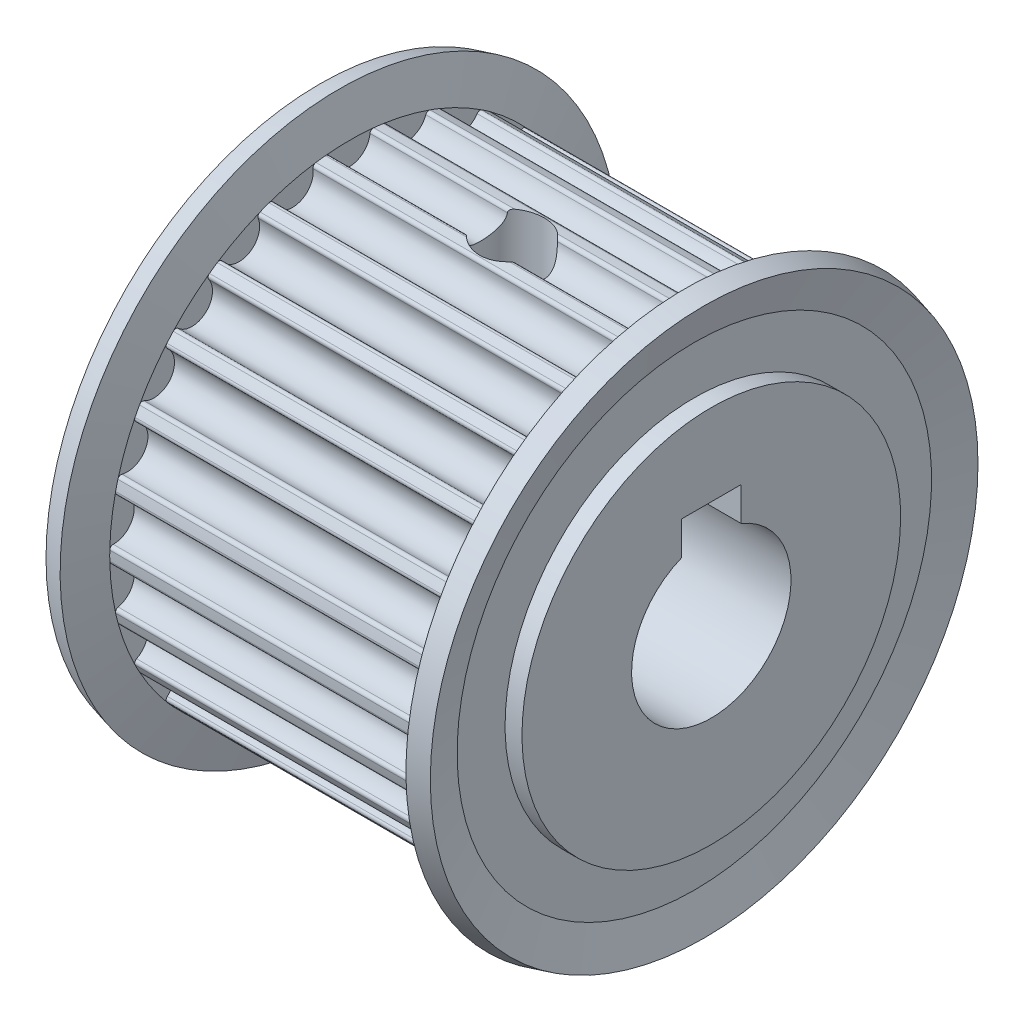
from build123d import *

# Parameters (mm, degrees)
CUT_EXTRUDE1_DEPTH       = 8.15
CUT_EXTRUDE1_DEPTH_BACK  = 8.15
CUT_EXTRUDE2_DEPTH       = 8.15
CUT_EXTRUDE2_DEPTH_BACK  = 8.15
CUT_EXTRUDE3_DEPTH       = 8.15
CUT_EXTRUDE3_DEPTH_BACK  = 8.15
CUT_EXTRUDE4_DEPTH       = 8.15
CUT_EXTRUDE4_DEPTH_BACK  = 8.15
CUT_EXTRUDE5_DEPTH       = 8.15
CUT_EXTRUDE5_DEPTH_BACK  = 8.15
CUT_EXTRUDE6_DEPTH       = 8.15
CUT_EXTRUDE6_DEPTH_BACK  = 8.15
CUT_EXTRUDE7_DEPTH       = 8.15
CUT_EXTRUDE7_DEPTH_BACK  = 8.15
CUT_EXTRUDE8_DEPTH       = 8.15
CUT_EXTRUDE8_DEPTH_BACK  = 8.15
CUT_EXTRUDE9_DEPTH       = 8.15
CUT_EXTRUDE9_DEPTH_BACK  = 8.15
CUT_EXTRUDE10_DEPTH      = 8.15
CUT_EXTRUDE10_DEPTH_BACK = 8.15
CUT_EXTRUDE11_DEPTH      = 8.15
CUT_EXTRUDE11_DEPTH_BACK = 8.15
CUT_EXTRUDE12_DEPTH      = 8.15
CUT_EXTRUDE12_DEPTH_BACK = 8.15
CUT_EXTRUDE13_DEPTH      = 8.15
CUT_EXTRUDE13_DEPTH_BACK = 8.15
CUT_EXTRUDE14_DEPTH      = 8.15
CUT_EXTRUDE14_DEPTH_BACK = 8.15
CUT_EXTRUDE15_DEPTH      = 8.15
CUT_EXTRUDE15_DEPTH_BACK = 8.15
CUT_EXTRUDE16_DEPTH      = 8.15
CUT_EXTRUDE16_DEPTH_BACK = 8.15
CUT_EXTRUDE17_DEPTH      = 8.15
CUT_EXTRUDE17_DEPTH_BACK = 8.15
CUT_EXTRUDE18_DEPTH      = 8.15
CUT_EXTRUDE18_DEPTH_BACK = 8.15
CUT_EXTRUDE19_DEPTH      = 8.15
CUT_EXTRUDE19_DEPTH_BACK = 8.15
CUT_EXTRUDE20_DEPTH      = 8.15
CUT_EXTRUDE20_DEPTH_BACK = 8.15
CUT_EXTRUDE21_DEPTH      = 8.15
CUT_EXTRUDE21_DEPTH_BACK = 8.15
CUT_EXTRUDE22_DEPTH      = 8.15
CUT_EXTRUDE22_DEPTH_BACK = 8.15
CUT_EXTRUDE23_DEPTH      = 8.15
CUT_EXTRUDE23_DEPTH_BACK = 8.15
CUT_EXTRUDE24_DEPTH      = 8.15
CUT_EXTRUDE24_DEPTH_BACK = 8.15
CUT_EXTRUDE25_DEPTH      = 8.15
CUT_EXTRUDE25_DEPTH_BACK = 8.15
CUT_EXTRUDE26_DEPTH      = 8.15
CUT_EXTRUDE26_DEPTH_BACK = 8.15
SKETCH28_W               = 20
SKETCH28_H               = 4
SKETCH29_W               = 1.621
SKETCH29_H               = 12.035
SKETCH31_W               = 3
SKETCH31_H               = 5.4
CUT_EXTRUDE27_DEPTH      = 20


with BuildPart() as part:
    # Sketch1 → Revolve1 (revolve)
    with BuildSketch(Plane.XY):
        Polygon((0, 0), (0, 9.5), (0.85, 9.5), (0.85, 11.903347502), (0.357554011, 13.741180955), (1.323479837, 14), (1.85, 12.035), (18.15, 12.035), (18.676520163, 14), (19.642445989, 13.741180955), (19.15, 11.903347502), (19.15, 9.5), (20, 9.5), (20, 0), align=None)
    revolve(axis=Axis((20, 0, 0), (-1, 0, 0)))

    # Sketch2 → Cut-Extrude1 (cut, two sides: drawn at the far end of the back side and taken through both)
    with BuildSketch(Plane(origin=(10, 0, 0), x_dir=(0, 0, -1), z_dir=(1, 0, 0)).offset(-CUT_EXTRUDE1_DEPTH_BACK)):
        with BuildLine():
            Line((-1.249308054, 12.3519818), (-1.211069064, 11.97391067))
            ThreePointArc((-1.211069064, 11.97391067), (-1.086431486, 11.936444223), (-1.024817519, 11.821805749))
            ThreePointArc((-1.024817519, 11.821805749), (1e-09, 10.895), (1.024817519, 11.821805751))
            ThreePointArc((1.024817519, 11.821805751), (1.086431486, 11.936444223), (1.211069064, 11.97391067))
            Line((1.211069064, 11.97391067), (1.249308054, 12.3519818))
            ThreePointArc((1.249308054, 12.3519818), (0, 12.415), (-1.249308054, 12.3519818))
        make_face()
    extrude(amount=CUT_EXTRUDE1_DEPTH + CUT_EXTRUDE1_DEPTH_BACK, mode=Mode.SUBTRACT)

    # Sketch3 → Cut-Extrude2 (cut, two sides: drawn at the far end of the back side and taken through both)
    with BuildSketch(Plane(origin=(10, 0, 0), x_dir=(0, 0, -1), z_dir=(1, 0, 0)).offset(-CUT_EXTRUDE2_DEPTH_BACK)):
        with BuildLine():
            Line((-4.169028162, 11.694076671), (-4.041421984, 11.33614279))
            ThreePointArc((-4.041421984, 11.33614279), (-3.91143984, 11.329592774), (-3.82418148, 11.233030674))
            ThreePointArc((-3.82418148, 11.233030674), (-2.607344162, 10.578411101), (-1.834105112, 11.723540446))
            ThreePointArc((-1.834105112, 11.723540446), (-1.801716317, 11.84959292), (-1.689666788, 11.915798385))
            Line((-1.689666788, 11.915798385), (-1.743017297, 12.292034644))
            ThreePointArc((-1.743017297, 12.292034644), (-2.971103972, 12.054242663), (-4.169028162, 11.694076671))
        make_face()
    extrude(amount=CUT_EXTRUDE2_DEPTH + CUT_EXTRUDE2_DEPTH_BACK, mode=Mode.SUBTRACT)

    # Sketch4 → Cut-Extrude3 (cut, two sides: drawn at the far end of the back side and taken through both)
    with BuildSketch(Plane(origin=(10, 0, 0), x_dir=(0, 0, -1), z_dir=(1, 0, 0)).offset(-CUT_EXTRUDE3_DEPTH_BACK)):
        with BuildLine():
            Line((-6.846459507, 10.356554312), (-6.636902148, 10.039559496))
            ThreePointArc((-6.636902148, 10.039559496), (-6.509129527, 10.064306575), (-6.401297914, 9.991432686))
            ThreePointArc((-6.401297914, 9.991432686), (-5.063158959, 9.6470434), (-4.58643622, 10.943945584))
            ThreePointArc((-4.58643622, 10.943945584), (-4.585154916, 11.074086349), (-4.492205348, 11.16518321))
            Line((-4.492205348, 11.16518321), (-4.634044819, 11.517719115))
            ThreePointArc((-4.634044819, 11.517719115), (-5.769538181, 10.992936558), (-6.846459507, 10.356554312))
        make_face()
    extrude(amount=CUT_EXTRUDE3_DEPTH + CUT_EXTRUDE3_DEPTH_BACK, mode=Mode.SUBTRACT)

    # Sketch5 → Cut-Extrude4 (cut, two sides: drawn at the far end of the back side and taken through both)
    with BuildSketch(Plane(origin=(10, 0, 0), x_dir=(0, 0, -1), z_dir=(1, 0, 0)).offset(-CUT_EXTRUDE4_DEPTH_BACK)):
        with BuildLine():
            Line((-9.125999512, 8.417146661), (-8.846669684, 8.159513497))
            ThreePointArc((-8.846669684, 8.159513497), (-8.728532267, 8.214119461), (-8.606394181, 8.169168949))
            ThreePointArc((-8.606394181, 8.169168949), (-7.224721361, 8.155024602), (-7.072220327, 9.528328384))
            ThreePointArc((-7.072220327, 9.528328384), (-7.102120978, 9.654994131), (-7.033673262, 9.765688171))
            Line((-7.033673262, 9.765688171), (-7.2557585, 10.074035616))
            ThreePointArc((-7.2557585, 10.074035616), (-8.232667802, 9.292760939), (-9.125999512, 8.417146661))
        make_face()
    extrude(amount=CUT_EXTRUDE4_DEPTH + CUT_EXTRUDE4_DEPTH_BACK, mode=Mode.SUBTRACT)

    # Sketch6 → Cut-Extrude5 (cut, two sides: drawn at the far end of the back side and taken through both)
    with BuildSketch(Plane(origin=(10, 0, 0), x_dir=(0, 0, -1), z_dir=(1, 0, 0)).offset(-CUT_EXTRUDE5_DEPTH_BACK)):
        with BuildLine():
            Line((-10.875169596, 5.988565041), (-10.542300934, 5.805266232))
            ThreePointArc((-10.542300934, 5.805266232), (-10.440664438, 5.88655758), (-10.311318101, 5.872142805))
            ThreePointArc((-10.311318101, 5.872142805), (-8.966409218, 6.189065416), (-9.146992694, 7.558959373))
            ThreePointArc((-9.146992694, 7.558959373), (-9.206337585, 7.674788749), (-9.166369652, 7.798646832))
            Line((-9.166369652, 7.798646832), (-9.45579387, 8.044885785))
            ThreePointArc((-9.45579387, 8.044885785), (-10.217344695, 7.052523831), (-10.875169596, 5.988565041))
        make_face()
    extrude(amount=CUT_EXTRUDE5_DEPTH + CUT_EXTRUDE5_DEPTH_BACK, mode=Mode.SUBTRACT)

    # Sketch7 → Cut-Extrude6 (cut, two sides: drawn at the far end of the back side and taken through both)
    with BuildSketch(Plane(origin=(10, 0, 0), x_dir=(0, 0, -1), z_dir=(1, 0, 0)).offset(-CUT_EXTRUDE6_DEPTH_BACK)):
        with BuildLine():
            Line((-11.992314354, 3.211949789), (-11.625251973, 3.113637995))
            ThreePointArc((-11.625251973, 3.113637995), (-11.546023142, 3.21689037), (-11.416985694, 3.233849067))
            ThreePointArc((-11.416985694, 3.233849067), (-10.187001964, 3.863420245), (-10.690175094, 5.150291119))
            ThreePointArc((-10.690175094, 5.150291119), (-10.775515314, 5.248552542), (-10.766349956, 5.378376486))
            Line((-10.766349956, 5.378376486), (-11.106292871, 5.548196433))
            ThreePointArc((-11.106292871, 5.548196433), (-11.608226653, 4.402419673), (-11.992314354, 3.211949789))
        make_face()
    extrude(amount=CUT_EXTRUDE6_DEPTH + CUT_EXTRUDE6_DEPTH_BACK, mode=Mode.SUBTRACT)

    # Sketch8 → Cut-Extrude7 (cut, two sides: drawn at the far end of the back side and taken through both)
    with BuildSketch(Plane(origin=(10, 0, 0), x_dir=(0, 0, -1), z_dir=(1, 0, 0)).offset(-CUT_EXTRUDE7_DEPTH_BACK)):
        with BuildLine():
            Line((-12.412509391, 0.248667689), (-12.032585624, 0.241056435))
            ThreePointArc((-12.032585624, 0.241056435), (-11.980368949, 0.360269184), (-11.859139576, 0.407615774))
            ThreePointArc((-11.859139576, 0.407615774), (-10.815563183, 1.313247132), (-11.612083375, 2.442306665))
            ThreePointArc((-11.612083375, 2.442306665), (-11.718459261, 2.517289538), (-11.740629135, 2.645534449))
            Line((-11.740629135, 2.645534449), (-12.1113345, 2.729066072))
            ThreePointArc((-12.1113345, 2.729066072), (-12.324480672, 1.496462885), (-12.412509391, 0.248667689))
        make_face()
    extrude(amount=CUT_EXTRUDE7_DEPTH + CUT_EXTRUDE7_DEPTH_BACK, mode=Mode.SUBTRACT)

    # Sketch9 → Cut-Extrude8 (cut, two sides: drawn at the far end of the back side and taken through both)
    with BuildSketch(Plane(origin=(10, 0, 0), x_dir=(0, 0, -1), z_dir=(1, 0, 0)).offset(-CUT_EXTRUDE8_DEPTH_BACK)):
        with BuildLine():
            Line((-12.1113345, -2.729066072), (-11.740629135, -2.645534449))
            ThreePointArc((-11.740629135, -2.645534449), (-11.71845926, -2.517289538), (-11.612083373, -2.442306665))
            ThreePointArc((-11.612083373, -2.442306665), (-10.815563183, -1.313247131), (-11.859139578, -0.407615775))
            ThreePointArc((-11.859139578, -0.407615775), (-11.98036895, -0.360269183), (-12.032585624, -0.241056435))
            Line((-12.032585624, -0.241056435), (-12.412509391, -0.248667689))
            ThreePointArc((-12.412509391, -0.248667689), (-12.324480672, -1.496462885), (-12.1113345, -2.729066072))
        make_face()
    extrude(amount=CUT_EXTRUDE8_DEPTH + CUT_EXTRUDE8_DEPTH_BACK, mode=Mode.SUBTRACT)

    # Sketch10 → Cut-Extrude9 (cut, two sides: drawn at the far end of the back side and taken through both)
    with BuildSketch(Plane(origin=(10, 0, 0), x_dir=(0, 0, -1), z_dir=(1, 0, 0)).offset(-CUT_EXTRUDE9_DEPTH_BACK)):
        with BuildLine():
            Line((-11.106292871, -5.548196433), (-10.766349956, -5.378376486))
            ThreePointArc((-10.766349956, -5.378376486), (-10.775515314, -5.248552541), (-10.690175093, -5.150291118))
            ThreePointArc((-10.690175093, -5.150291118), (-10.187001964, -3.863420244), (-11.416985695, -3.233849067))
            ThreePointArc((-11.416985695, -3.233849067), (-11.546023143, -3.216890369), (-11.625251973, -3.113637995))
            Line((-11.625251973, -3.113637995), (-11.992314354, -3.211949789))
            ThreePointArc((-11.992314354, -3.211949789), (-11.608226653, -4.402419673), (-11.106292871, -5.548196433))
        make_face()
    extrude(amount=CUT_EXTRUDE9_DEPTH + CUT_EXTRUDE9_DEPTH_BACK, mode=Mode.SUBTRACT)

    # Sketch11 → Cut-Extrude10 (cut, two sides: drawn at the far end of the back side and taken through both)
    with BuildSketch(Plane(origin=(10, 0, 0), x_dir=(0, 0, -1), z_dir=(1, 0, 0)).offset(-CUT_EXTRUDE10_DEPTH_BACK)):
        with BuildLine():
            Line((-9.45579387, -8.044885785), (-9.166369652, -7.798646832))
            ThreePointArc((-9.166369652, -7.798646832), (-9.206337585, -7.674788748), (-9.146992693, -7.558959372))
            ThreePointArc((-9.146992693, -7.558959372), (-8.966409219, -6.189065415), (-10.311318103, -5.872142806))
            ThreePointArc((-10.311318103, -5.872142806), (-10.440664439, -5.88655758), (-10.542300934, -5.805266232))
            Line((-10.542300934, -5.805266232), (-10.875169596, -5.988565041))
            ThreePointArc((-10.875169596, -5.988565041), (-10.217344695, -7.052523831), (-9.45579387, -8.044885785))
        make_face()
    extrude(amount=CUT_EXTRUDE10_DEPTH + CUT_EXTRUDE10_DEPTH_BACK, mode=Mode.SUBTRACT)

    # Sketch12 → Cut-Extrude11 (cut, two sides: drawn at the far end of the back side and taken through both)
    with BuildSketch(Plane(origin=(10, 0, 0), x_dir=(0, 0, -1), z_dir=(1, 0, 0)).offset(-CUT_EXTRUDE11_DEPTH_BACK)):
        with BuildLine():
            Line((-7.2557585, -10.074035616), (-7.033673262, -9.765688171))
            ThreePointArc((-7.033673262, -9.765688171), (-7.102120979, -9.65499413), (-7.072220326, -9.528328383))
            ThreePointArc((-7.072220326, -9.528328383), (-7.224721362, -8.155024601), (-8.606394182, -8.16916895))
            ThreePointArc((-8.606394182, -8.16916895), (-8.728532268, -8.214119461), (-8.846669684, -8.159513497))
            Line((-8.846669684, -8.159513497), (-9.125999512, -8.417146661))
            ThreePointArc((-9.125999512, -8.417146661), (-8.232667802, -9.292760939), (-7.2557585, -10.074035616))
        make_face()
    extrude(amount=CUT_EXTRUDE11_DEPTH + CUT_EXTRUDE11_DEPTH_BACK, mode=Mode.SUBTRACT)

    # Sketch13 → Cut-Extrude12 (cut, two sides: drawn at the far end of the back side and taken through both)
    with BuildSketch(Plane(origin=(10, 0, 0), x_dir=(0, 0, -1), z_dir=(1, 0, 0)).offset(-CUT_EXTRUDE12_DEPTH_BACK)):
        with BuildLine():
            Line((-4.634044819, -11.517719115), (-4.492205348, -11.16518321))
            ThreePointArc((-4.492205348, -11.16518321), (-4.585154917, -11.074086348), (-4.58643622, -10.943945583))
            ThreePointArc((-4.58643622, -10.943945583), (-5.06315896, -9.647043399), (-6.401297915, -9.991432688))
            ThreePointArc((-6.401297915, -9.991432688), (-6.509129528, -10.064306576), (-6.636902148, -10.039559496))
            Line((-6.636902148, -10.039559496), (-6.846459507, -10.356554312))
            ThreePointArc((-6.846459507, -10.356554312), (-5.769538181, -10.992936558), (-4.634044819, -11.517719115))
        make_face()
    extrude(amount=CUT_EXTRUDE12_DEPTH + CUT_EXTRUDE12_DEPTH_BACK, mode=Mode.SUBTRACT)

    # Sketch14 → Cut-Extrude13 (cut, two sides: drawn at the far end of the back side and taken through both)
    with BuildSketch(Plane(origin=(10, 0, 0), x_dir=(0, 0, -1), z_dir=(1, 0, 0)).offset(-CUT_EXTRUDE13_DEPTH_BACK)):
        with BuildLine():
            Line((-1.743017297, -12.292034644), (-1.689666788, -11.915798385))
            ThreePointArc((-1.689666788, -11.915798385), (-1.801716317, -11.84959292), (-1.834105112, -11.723540444))
            ThreePointArc((-1.834105112, -11.723540444), (-2.607344163, -10.578411101), (-3.824181481, -11.233030675))
            ThreePointArc((-3.824181481, -11.233030675), (-3.91143984, -11.329592775), (-4.041421984, -11.33614279))
            Line((-4.041421984, -11.33614279), (-4.169028162, -11.694076671))
            ThreePointArc((-4.169028162, -11.694076671), (-2.971103972, -12.054242663), (-1.743017297, -12.292034644))
        make_face()
    extrude(amount=CUT_EXTRUDE13_DEPTH + CUT_EXTRUDE13_DEPTH_BACK, mode=Mode.SUBTRACT)

    # Sketch15 → Cut-Extrude14 (cut, two sides: drawn at the far end of the back side and taken through both)
    with BuildSketch(Plane(origin=(10, 0, 0), x_dir=(0, 0, -1), z_dir=(1, 0, 0)).offset(-CUT_EXTRUDE14_DEPTH_BACK)):
        with BuildLine():
            Line((1.249308054, -12.3519818), (1.211069064, -11.97391067))
            ThreePointArc((1.211069064, -11.97391067), (1.086431486, -11.936444223), (1.024817519, -11.821805749))
            ThreePointArc((1.024817519, -11.821805749), (-1e-09, -10.895), (-1.024817519, -11.821805751))
            ThreePointArc((-1.024817519, -11.821805751), (-1.086431486, -11.936444223), (-1.211069064, -11.97391067))
            Line((-1.211069064, -11.97391067), (-1.249308054, -12.3519818))
            ThreePointArc((-1.249308054, -12.3519818), (0, -12.415), (1.249308054, -12.3519818))
        make_face()
    extrude(amount=CUT_EXTRUDE14_DEPTH + CUT_EXTRUDE14_DEPTH_BACK, mode=Mode.SUBTRACT)

    # Sketch16 → Cut-Extrude15 (cut, two sides: drawn at the far end of the back side and taken through both)
    with BuildSketch(Plane(origin=(10, 0, 0), x_dir=(0, 0, -1), z_dir=(1, 0, 0)).offset(-CUT_EXTRUDE15_DEPTH_BACK)):
        with BuildLine():
            Line((4.169028162, -11.694076671), (4.041421984, -11.33614279))
            ThreePointArc((4.041421984, -11.33614279), (3.91143984, -11.329592774), (3.82418148, -11.233030674))
            ThreePointArc((3.82418148, -11.233030674), (2.607344162, -10.578411101), (1.834105112, -11.723540446))
            ThreePointArc((1.834105112, -11.723540446), (1.801716317, -11.84959292), (1.689666788, -11.915798385))
            Line((1.689666788, -11.915798385), (1.743017297, -12.292034644))
            ThreePointArc((1.743017297, -12.292034644), (2.971103972, -12.054242663), (4.169028162, -11.694076671))
        make_face()
    extrude(amount=CUT_EXTRUDE15_DEPTH + CUT_EXTRUDE15_DEPTH_BACK, mode=Mode.SUBTRACT)

    # Sketch17 → Cut-Extrude16 (cut, two sides: drawn at the far end of the back side and taken through both)
    with BuildSketch(Plane(origin=(10, 0, 0), x_dir=(0, 0, -1), z_dir=(1, 0, 0)).offset(-CUT_EXTRUDE16_DEPTH_BACK)):
        with BuildLine():
            Line((6.846459507, -10.356554312), (6.636902148, -10.039559496))
            ThreePointArc((6.636902148, -10.039559496), (6.509129527, -10.064306575), (6.401297914, -9.991432686))
            ThreePointArc((6.401297914, -9.991432686), (5.063158959, -9.6470434), (4.58643622, -10.943945584))
            ThreePointArc((4.58643622, -10.943945584), (4.585154916, -11.074086349), (4.492205348, -11.16518321))
            Line((4.492205348, -11.16518321), (4.634044819, -11.517719115))
            ThreePointArc((4.634044819, -11.517719115), (5.769538181, -10.992936558), (6.846459507, -10.356554312))
        make_face()
    extrude(amount=CUT_EXTRUDE16_DEPTH + CUT_EXTRUDE16_DEPTH_BACK, mode=Mode.SUBTRACT)

    # Sketch18 → Cut-Extrude17 (cut, two sides: drawn at the far end of the back side and taken through both)
    with BuildSketch(Plane(origin=(10, 0, 0), x_dir=(0, 0, -1), z_dir=(1, 0, 0)).offset(-CUT_EXTRUDE17_DEPTH_BACK)):
        with BuildLine():
            Line((9.125999512, -8.417146661), (8.846669684, -8.159513497))
            ThreePointArc((8.846669684, -8.159513497), (8.728532267, -8.214119461), (8.606394181, -8.169168949))
            ThreePointArc((8.606394181, -8.169168949), (7.224721361, -8.155024602), (7.072220327, -9.528328384))
            ThreePointArc((7.072220327, -9.528328384), (7.102120978, -9.654994131), (7.033673262, -9.765688171))
            Line((7.033673262, -9.765688171), (7.2557585, -10.074035616))
            ThreePointArc((7.2557585, -10.074035616), (8.232667802, -9.292760939), (9.125999512, -8.417146661))
        make_face()
    extrude(amount=CUT_EXTRUDE17_DEPTH + CUT_EXTRUDE17_DEPTH_BACK, mode=Mode.SUBTRACT)

    # Sketch19 → Cut-Extrude18 (cut, two sides: drawn at the far end of the back side and taken through both)
    with BuildSketch(Plane(origin=(10, 0, 0), x_dir=(0, 0, -1), z_dir=(1, 0, 0)).offset(-CUT_EXTRUDE18_DEPTH_BACK)):
        with BuildLine():
            Line((10.875169596, -5.988565041), (10.542300934, -5.805266232))
            ThreePointArc((10.542300934, -5.805266232), (10.440664438, -5.88655758), (10.311318101, -5.872142805))
            ThreePointArc((10.311318101, -5.872142805), (8.966409218, -6.189065416), (9.146992694, -7.558959373))
            ThreePointArc((9.146992694, -7.558959373), (9.206337585, -7.674788749), (9.166369652, -7.798646832))
            Line((9.166369652, -7.798646832), (9.45579387, -8.044885785))
            ThreePointArc((9.45579387, -8.044885785), (10.217344695, -7.052523831), (10.875169596, -5.988565041))
        make_face()
    extrude(amount=CUT_EXTRUDE18_DEPTH + CUT_EXTRUDE18_DEPTH_BACK, mode=Mode.SUBTRACT)

    # Sketch20 → Cut-Extrude19 (cut, two sides: drawn at the far end of the back side and taken through both)
    with BuildSketch(Plane(origin=(10, 0, 0), x_dir=(0, 0, -1), z_dir=(1, 0, 0)).offset(-CUT_EXTRUDE19_DEPTH_BACK)):
        with BuildLine():
            Line((11.992314354, -3.211949789), (11.625251973, -3.113637995))
            ThreePointArc((11.625251973, -3.113637995), (11.546023142, -3.21689037), (11.416985694, -3.233849067))
            ThreePointArc((11.416985694, -3.233849067), (10.187001964, -3.863420245), (10.690175094, -5.150291119))
            ThreePointArc((10.690175094, -5.150291119), (10.775515314, -5.248552542), (10.766349956, -5.378376486))
            Line((10.766349956, -5.378376486), (11.106292871, -5.548196433))
            ThreePointArc((11.106292871, -5.548196433), (11.608226653, -4.402419673), (11.992314354, -3.211949789))
        make_face()
    extrude(amount=CUT_EXTRUDE19_DEPTH + CUT_EXTRUDE19_DEPTH_BACK, mode=Mode.SUBTRACT)

    # Sketch21 → Cut-Extrude20 (cut, two sides: drawn at the far end of the back side and taken through both)
    with BuildSketch(Plane(origin=(10, 0, 0), x_dir=(0, 0, -1), z_dir=(1, 0, 0)).offset(-CUT_EXTRUDE20_DEPTH_BACK)):
        with BuildLine():
            Line((12.412509391, -0.248667689), (12.032585624, -0.241056435))
            ThreePointArc((12.032585624, -0.241056435), (11.980368949, -0.360269184), (11.859139576, -0.407615774))
            ThreePointArc((11.859139576, -0.407615774), (10.815563183, -1.313247132), (11.612083375, -2.442306665))
            ThreePointArc((11.612083375, -2.442306665), (11.718459261, -2.517289538), (11.740629135, -2.645534449))
            Line((11.740629135, -2.645534449), (12.1113345, -2.729066072))
            ThreePointArc((12.1113345, -2.729066072), (12.324480672, -1.496462885), (12.412509391, -0.248667689))
        make_face()
    extrude(amount=CUT_EXTRUDE20_DEPTH + CUT_EXTRUDE20_DEPTH_BACK, mode=Mode.SUBTRACT)

    # Sketch22 → Cut-Extrude21 (cut, two sides: drawn at the far end of the back side and taken through both)
    with BuildSketch(Plane(origin=(10, 0, 0), x_dir=(0, 0, -1), z_dir=(1, 0, 0)).offset(-CUT_EXTRUDE21_DEPTH_BACK)):
        with BuildLine():
            Line((12.1113345, 2.729066072), (11.740629135, 2.645534449))
            ThreePointArc((11.740629135, 2.645534449), (11.71845926, 2.517289538), (11.612083373, 2.442306665))
            ThreePointArc((11.612083373, 2.442306665), (10.815563183, 1.313247131), (11.859139578, 0.407615775))
            ThreePointArc((11.859139578, 0.407615775), (11.98036895, 0.360269183), (12.032585624, 0.241056435))
            Line((12.032585624, 0.241056435), (12.412509391, 0.248667689))
            ThreePointArc((12.412509391, 0.248667689), (12.324480672, 1.496462885), (12.1113345, 2.729066072))
        make_face()
    extrude(amount=CUT_EXTRUDE21_DEPTH + CUT_EXTRUDE21_DEPTH_BACK, mode=Mode.SUBTRACT)

    # Sketch23 → Cut-Extrude22 (cut, two sides: drawn at the far end of the back side and taken through both)
    with BuildSketch(Plane(origin=(10, 0, 0), x_dir=(0, 0, -1), z_dir=(1, 0, 0)).offset(-CUT_EXTRUDE22_DEPTH_BACK)):
        with BuildLine():
            Line((11.106292871, 5.548196433), (10.766349956, 5.378376486))
            ThreePointArc((10.766349956, 5.378376486), (10.775515314, 5.248552541), (10.690175093, 5.150291118))
            ThreePointArc((10.690175093, 5.150291118), (10.187001964, 3.863420244), (11.416985695, 3.233849067))
            ThreePointArc((11.416985695, 3.233849067), (11.546023143, 3.216890369), (11.625251973, 3.113637995))
            Line((11.625251973, 3.113637995), (11.992314354, 3.211949789))
            ThreePointArc((11.992314354, 3.211949789), (11.608226653, 4.402419673), (11.106292871, 5.548196433))
        make_face()
    extrude(amount=CUT_EXTRUDE22_DEPTH + CUT_EXTRUDE22_DEPTH_BACK, mode=Mode.SUBTRACT)

    # Sketch24 → Cut-Extrude23 (cut, two sides: drawn at the far end of the back side and taken through both)
    with BuildSketch(Plane(origin=(10, 0, 0), x_dir=(0, 0, -1), z_dir=(1, 0, 0)).offset(-CUT_EXTRUDE23_DEPTH_BACK)):
        with BuildLine():
            Line((9.45579387, 8.044885785), (9.166369652, 7.798646832))
            ThreePointArc((9.166369652, 7.798646832), (9.206337585, 7.674788748), (9.146992693, 7.558959372))
            ThreePointArc((9.146992693, 7.558959372), (8.966409219, 6.189065415), (10.311318103, 5.872142806))
            ThreePointArc((10.311318103, 5.872142806), (10.440664439, 5.88655758), (10.542300934, 5.805266232))
            Line((10.542300934, 5.805266232), (10.875169596, 5.988565041))
            ThreePointArc((10.875169596, 5.988565041), (10.217344695, 7.052523831), (9.45579387, 8.044885785))
        make_face()
    extrude(amount=CUT_EXTRUDE23_DEPTH + CUT_EXTRUDE23_DEPTH_BACK, mode=Mode.SUBTRACT)

    # Sketch25 → Cut-Extrude24 (cut, two sides: drawn at the far end of the back side and taken through both)
    with BuildSketch(Plane(origin=(10, 0, 0), x_dir=(0, 0, -1), z_dir=(1, 0, 0)).offset(-CUT_EXTRUDE24_DEPTH_BACK)):
        with BuildLine():
            Line((7.2557585, 10.074035616), (7.033673262, 9.765688171))
            ThreePointArc((7.033673262, 9.765688171), (7.102120979, 9.65499413), (7.072220326, 9.528328383))
            ThreePointArc((7.072220326, 9.528328383), (7.224721362, 8.155024601), (8.606394182, 8.16916895))
            ThreePointArc((8.606394182, 8.16916895), (8.728532268, 8.214119461), (8.846669684, 8.159513497))
            Line((8.846669684, 8.159513497), (9.125999512, 8.417146661))
            ThreePointArc((9.125999512, 8.417146661), (8.232667802, 9.292760939), (7.2557585, 10.074035616))
        make_face()
    extrude(amount=CUT_EXTRUDE24_DEPTH + CUT_EXTRUDE24_DEPTH_BACK, mode=Mode.SUBTRACT)

    # Sketch26 → Cut-Extrude25 (cut, two sides: drawn at the far end of the back side and taken through both)
    with BuildSketch(Plane(origin=(10, 0, 0), x_dir=(0, 0, -1), z_dir=(1, 0, 0)).offset(-CUT_EXTRUDE25_DEPTH_BACK)):
        with BuildLine():
            Line((4.634044819, 11.517719115), (4.492205348, 11.16518321))
            ThreePointArc((4.492205348, 11.16518321), (4.585154917, 11.074086348), (4.58643622, 10.943945583))
            ThreePointArc((4.58643622, 10.943945583), (5.06315896, 9.647043399), (6.401297915, 9.991432688))
            ThreePointArc((6.401297915, 9.991432688), (6.509129528, 10.064306576), (6.636902148, 10.039559496))
            Line((6.636902148, 10.039559496), (6.846459507, 10.356554312))
            ThreePointArc((6.846459507, 10.356554312), (5.769538181, 10.992936558), (4.634044819, 11.517719115))
        make_face()
    extrude(amount=CUT_EXTRUDE25_DEPTH + CUT_EXTRUDE25_DEPTH_BACK, mode=Mode.SUBTRACT)

    # Sketch27 → Cut-Extrude26 (cut, two sides: drawn at the far end of the back side and taken through both)
    with BuildSketch(Plane(origin=(10, 0, 0), x_dir=(0, 0, -1), z_dir=(1, 0, 0)).offset(-CUT_EXTRUDE26_DEPTH_BACK)):
        with BuildLine():
            Line((1.743017297, 12.292034644), (1.689666788, 11.915798385))
            ThreePointArc((1.689666788, 11.915798385), (1.801716317, 11.84959292), (1.834105112, 11.723540444))
            ThreePointArc((1.834105112, 11.723540444), (2.607344163, 10.578411101), (3.824181481, 11.233030675))
            ThreePointArc((3.824181481, 11.233030675), (3.91143984, 11.329592775), (4.041421984, 11.33614279))
            Line((4.041421984, 11.33614279), (4.169028162, 11.694076671))
            ThreePointArc((4.169028162, 11.694076671), (2.971103972, 12.054242663), (1.743017297, 12.292034644))
        make_face()
    extrude(amount=CUT_EXTRUDE26_DEPTH + CUT_EXTRUDE26_DEPTH_BACK, mode=Mode.SUBTRACT)

    # Sketch28 → Cut-Revolve1 (revolve, cut)
    with BuildSketch(Plane.XY):
        with Locations((10, 2)):
            Rectangle(SKETCH28_W, SKETCH28_H)
    revolve(axis=Axis((20, 0, 0), (-1, 0, 0)), mode=Mode.SUBTRACT)

    # Sketch29 → Cut-Revolve2 (revolve, cut)
    with BuildSketch(Plane(origin=(10, 0, 0), x_dir=(0, 0, -1), z_dir=(1, 0, 0))):
        with Locations((0.8105, 6.0175)):
            Rectangle(SKETCH29_W, SKETCH29_H)
    revolve(axis=Axis((10, 0, 0), (0, 1, 0)), mode=Mode.SUBTRACT)

    # Sketch30 → Cut-Revolve3 (revolve, cut)
    with BuildSketch(Plane(origin=(10, 0, 0), x_dir=(0, 0, -1), z_dir=(1, 0, 0))):
        Polygon((9.90461078, -6.836659293), (8.983777817, -8.170716134), (-0.920832963, -1.33405684), (0, 0), align=None)
    revolve(axis=Axis((10, 0, 0), (0, -0.5680647522556864, -0.8229838620803482)), mode=Mode.SUBTRACT)

    # Sketch31 → Cut-Extrude27 (cut)
    with BuildSketch(Plane(origin=(0, 0, 0), x_dir=(0, 0, -1), z_dir=(1, 0, 0))):
        with Locations((0, 2.7)):
            Rectangle(SKETCH31_W, SKETCH31_H)
    extrude(amount=CUT_EXTRUDE27_DEPTH, mode=Mode.SUBTRACT)


solid = part.part
